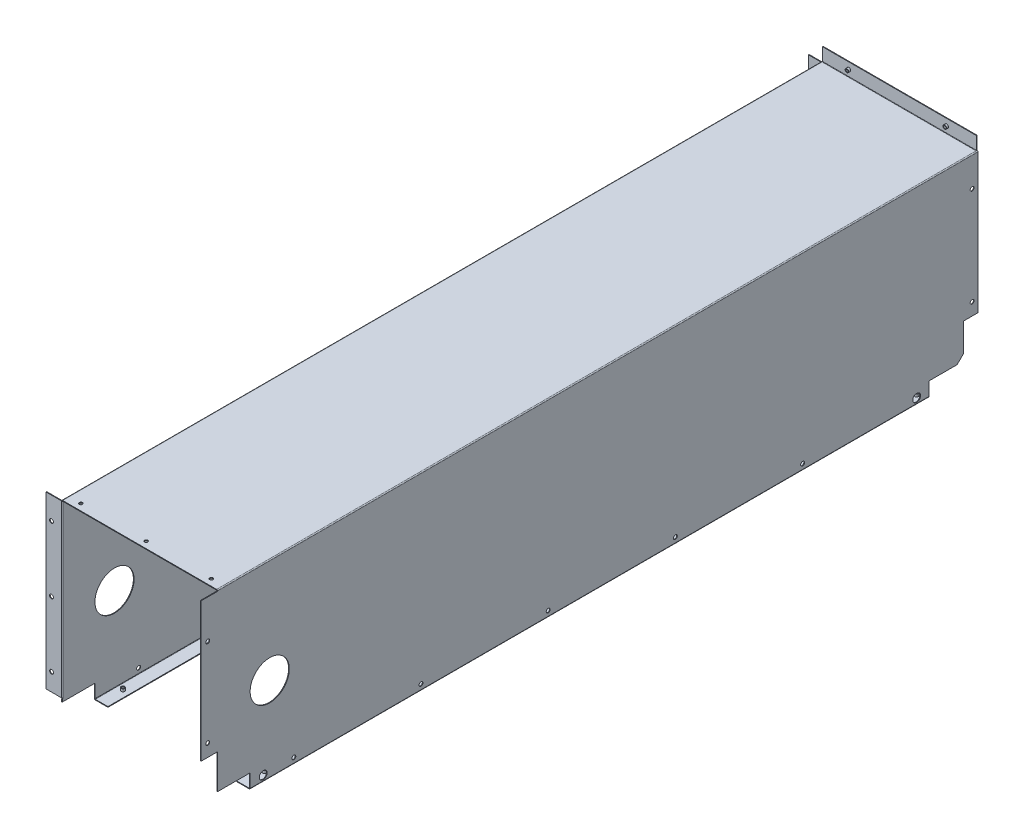
from build123d import *

# Parameters (mm, degrees)
SM_BASE_FLANGE_1_DEPTH           = 583
CUT_EXTRUDE_1_REACH              = 695.621
CHAMFER_1_SIZE                   = 10
CUT_EXTRUDE_2_REACH              = 695.621
SKETCH_4_W                       = 108.020797234
SKETCH_4_H                       = 89.185663408
SKETCH_4_W_2                     = 69.975402199
SKETCH_4_H_2                     = 56.987896811
CUT_EXTRUDE_3_REACH              = 695.621
SKETCH_8_R                       = 60
SKETCH_8_R_2                     = 3
SKETCH_9_R                       = 30
CUT_EXTRUDE_4_DEPTH              = 694.62093394
CUT_EXTRUDE_5_REACH              = 695.621
SKETCH_10_W                      = 58.039698727
SKETCH_10_H                      = 28.57153795
SKETCH_11_W                      = 25
SKETCH_11_H                      = 213
SM_BASE_FLANGE_1_2_DEPTH         = 1
CUT_EXTRUDE_6_REACH              = 716.762
SKETCH_14_R                      = 3
SKETCH_14_R_2                    = 6
CUT_EXTRUDE_7_REACH              = 716.762
SKETCH_15_R                      = 3
CUT_EXTRUDE_8_REACH              = 685.714
SKETCH_16_R                      = 2.5
SM_EDGE_FLANGE_1_STRIP_W         = 5
SM_EDGE_FLANGE_1_STRIP_H         = 1
SM_EDGE_FLANGE_1_STRIP_CUT_DEPTH = 236
SM_EDGE_FLANGE_1_DEPTH           = 236
SM_EDGE_FLANGE_2_STRIP_W         = 5
SM_EDGE_FLANGE_2_STRIP_H         = 1
SM_EDGE_FLANGE_2_STRIP_CUT_DEPTH = 261.5
SM_EDGE_FLANGE_2_DEPTH           = 261.5
SM_START                         = -263.5
SM_EDGE_FLANGE_3_DEPTH           = 262
SM_EDGE_FLANGE_3_2_DEPTH         = 0.5
SM_START_2                       = -263
SM_EDGE_FLANGE_3_3_DEPTH         = 261.5
SM_EDGE_FLANGE_4_STRIP_W         = 5
SM_EDGE_FLANGE_4_STRIP_H         = 1
SM_EDGE_FLANGE_4_STRIP_CUT_DEPTH = 1042
SM_EDGE_FLANGE_4_DEPTH           = 1042
SM_EDGE_FLANGE_5_STRIP_W         = 5
SM_EDGE_FLANGE_5_STRIP_H         = 1
SM_EDGE_FLANGE_5_STRIP_CUT_DEPTH = 1041
SM_EDGE_FLANGE_5_DEPTH           = 1041
CUT_EXTRUDE_9_REACH              = 1211.098
SKETCH_32_R                      = 3
SKETCH_33_R                      = 2.75
EXTRUDE_1_DEPTH                  = 4
HOLE_WIZARD_M4_1_D               = 3.3
HOLE_WIZARD_M4_1_DEPTH           = 10.1
HOLE_WIZARD_M4_1_TIP             = 0.991420021
SKETCH_40_R                      = 2.75
EXTRUDE_2_DEPTH                  = 5
HOLE_WIZARD_M4_2_D               = 3.3
HOLE_WIZARD_M4_2_DEPTH           = 10.1
HOLE_WIZARD_M4_2_TIP             = 0.991420021


# Read off the part's stored shape, not the designer's step: 边线-法兰3
# Sheet-metal steps are written as plain solids
with BuildPart() as part:
    # Sketch 1 → Sm Base Flange 1 (new, symmetric)
    with BuildSketch(Plane.XY):
        with BuildLine():
            Line((-119.5, -290), (-119.5, -1.5))
            ThreePointArc((-119.5, -1.5), (-119.060660172, -0.439339828), (-118, 0))
            Line((-118, 0), (118, 0))
            ThreePointArc((118, 0), (119.060660172, -0.439339828), (119.5, -1.5))
            Line((119.5, -1.5), (119.5, -290))
            Line((119.5, -290), (118.5, -290))
            Line((118.5, -290), (118.5, -1.5))
            ThreePointArc((118.5, -1.5), (118.353553391, -1.146446609), (118, -1))
            Line((118, -1), (-118, -1))
            ThreePointArc((-118, -1), (-118.353553391, -1.146446609), (-118.5, -1.5))
            Line((-118.5, -1.5), (-118.5, -290))
            Line((-118.5, -290), (-119.5, -290))
        make_face()
    extrude(amount=SM_BASE_FLANGE_1_DEPTH, both=True)

    # 草图3 → 切除-拉伸1 (cut, up to next)
    with BuildSketch(Plane(origin=(119.5, 0, 0), x_dir=(0, 0, -1), z_dir=(1, 0, 0)), mode=Mode.PRIVATE) as cut_extrude_1_sk1:
        Polygon((593.613938017, -215), (561, -215), (561, -268), (508, -268), (508, -307.31737372), (593.613938017, -307.31737372), align=None)
    cut_extrude_1_tool1 = extrude(cut_extrude_1_sk1.sketch, amount=-CUT_EXTRUDE_1_REACH, mode=Mode.PRIVATE) & part.part
    add(cut_extrude_1_tool1.solids().sort_by_distance((119.5, -271.997745, -559.798017))[0], mode=Mode.SUBTRACT)

    # 倒角1
    chamfer_1_edges = [part.edges().sort_by_distance(p)[0] for p in [
        (119, -268, -561),
    ]]
    chamfer(chamfer_1_edges, length=CHAMFER_1_SIZE)

    # 草图4 → 切除-拉伸2 (cut, up to next)
    with BuildSketch(Plane.ZY.offset(119.5), mode=Mode.PRIVATE) as cut_extrude_2_sk1:
        with Locations((-563.010398617, -307.592831704)):
            Rectangle(SKETCH_4_W, SKETCH_4_H)
    cut_extrude_2_tool1 = extrude(cut_extrude_2_sk1.sketch, amount=-CUT_EXTRUDE_2_REACH, mode=Mode.PRIVATE) & part.part
    # 草图4 → 切除-拉伸2 (cut, up to next)
    with BuildSketch(Plane.ZY.offset(119.5), mode=Mode.PRIVATE) as cut_extrude_2_sk2:
        with Locations((567.9877011, -296.493948406)):
            Rectangle(SKETCH_4_W_2, SKETCH_4_H_2)
    cut_extrude_2_tool2 = extrude(cut_extrude_2_sk2.sketch, amount=-CUT_EXTRUDE_2_REACH, mode=Mode.PRIVATE) & part.part
    add(cut_extrude_2_tool1.solids().sort_by_distance((-119.5, -307.592832, -563.010399))[0], mode=Mode.SUBTRACT)
    add(cut_extrude_2_tool2.solids().sort_by_distance((-119.5, -296.493948, 567.987701))[0], mode=Mode.SUBTRACT)

    # 草图8 → 切除-拉伸3 (cut, up to next)
    with BuildSketch(Plane.ZY.offset(119.5), mode=Mode.PRIVATE) as cut_extrude_3_sk1:
        with Locations((-414.5, -105)):
            Circle(SKETCH_8_R)
    cut_extrude_3_tool1 = extrude(cut_extrude_3_sk1.sketch, amount=-CUT_EXTRUDE_3_REACH, mode=Mode.PRIVATE) & part.part
    # 草图8 → 切除-拉伸3 (cut, up to next)
    with BuildSketch(Plane.ZY.offset(119.5), mode=Mode.PRIVATE) as cut_extrude_3_sk2:
        with Locations((-467, -157.5)):
            Circle(SKETCH_8_R_2)
    cut_extrude_3_tool2 = extrude(cut_extrude_3_sk2.sketch, amount=-CUT_EXTRUDE_3_REACH, mode=Mode.PRIVATE) & part.part
    # 草图8 → 切除-拉伸3 (cut, up to next)
    with BuildSketch(Plane.ZY.offset(119.5), mode=Mode.PRIVATE) as cut_extrude_3_sk3:
        with Locations((-467, -52.5)):
            Circle(SKETCH_8_R_2)
    cut_extrude_3_tool3 = extrude(cut_extrude_3_sk3.sketch, amount=-CUT_EXTRUDE_3_REACH, mode=Mode.PRIVATE) & part.part
    # 草图8 → 切除-拉伸3 (cut, up to next)
    with BuildSketch(Plane.ZY.offset(119.5), mode=Mode.PRIVATE) as cut_extrude_3_sk4:
        with Locations((-362, -52.5)):
            Circle(SKETCH_8_R_2)
    cut_extrude_3_tool4 = extrude(cut_extrude_3_sk4.sketch, amount=-CUT_EXTRUDE_3_REACH, mode=Mode.PRIVATE) & part.part
    # 草图8 → 切除-拉伸3 (cut, up to next)
    with BuildSketch(Plane.ZY.offset(119.5), mode=Mode.PRIVATE) as cut_extrude_3_sk5:
        with Locations((-362, -157.5)):
            Circle(SKETCH_8_R_2)
    cut_extrude_3_tool5 = extrude(cut_extrude_3_sk5.sketch, amount=-CUT_EXTRUDE_3_REACH, mode=Mode.PRIVATE) & part.part
    add(cut_extrude_3_tool1.solids().sort_by_distance((-119.5, -105, -414.5))[0], mode=Mode.SUBTRACT)
    add(cut_extrude_3_tool2.solids().sort_by_distance((-119.5, -157.5, -467))[0], mode=Mode.SUBTRACT)
    add(cut_extrude_3_tool3.solids().sort_by_distance((-119.5, -52.5, -467))[0], mode=Mode.SUBTRACT)
    add(cut_extrude_3_tool4.solids().sort_by_distance((-119.5, -52.5, -362))[0], mode=Mode.SUBTRACT)
    add(cut_extrude_3_tool5.solids().sort_by_distance((-119.5, -157.5, -362))[0], mode=Mode.SUBTRACT)

    # 草图9 → 切除-拉伸4 (cut, through all)
    with BuildSketch(Plane.ZY.offset(119.5)):
        with Locations((503, -160)):
            Circle(SKETCH_9_R)
    extrude(amount=-CUT_EXTRUDE_4_DEPTH, mode=Mode.SUBTRACT)

    # 草图10 → 切除-拉伸5 (cut, up to next)
    with BuildSketch(Plane(origin=(119.5, 0, 0), x_dir=(0, 0, -1), z_dir=(1, 0, 0)), mode=Mode.PRIVATE) as cut_extrude_5_sk1:
        with Locations((-562.019849364, -282.285768975)):
            Rectangle(SKETCH_10_W, SKETCH_10_H)
    cut_extrude_5_tool1 = extrude(cut_extrude_5_sk1.sketch, amount=-CUT_EXTRUDE_5_REACH, mode=Mode.PRIVATE) & part.part
    add(cut_extrude_5_tool1.solids().sort_by_distance((119.5, -282.285769, 562.019849))[0], mode=Mode.SUBTRACT)

    # 草图11 → Sm Base Flange 1 2 (add)
    with BuildSketch(Plane(origin=(119.5, 0, 0), x_dir=(0, 0, -1), z_dir=(1, 0, 0))):
        with Locations((-595.5, -108.5)):
            Rectangle(SKETCH_11_W, SKETCH_11_H)
    extrude(amount=-SM_BASE_FLANGE_1_2_DEPTH)

    # 草图14 → 切除-拉伸6 (cut, up to next)
    with BuildSketch(Plane(origin=(119.5, 0, 0), x_dir=(0, 0, -1), z_dir=(1, 0, 0)), mode=Mode.PRIVATE) as cut_extrude_6_sk1:
        with Locations((-598, -61)):
            Circle(SKETCH_14_R)
    cut_extrude_6_tool1 = extrude(cut_extrude_6_sk1.sketch, amount=-CUT_EXTRUDE_6_REACH, mode=Mode.PRIVATE) & part.part
    # 草图14 → 切除-拉伸6 (cut, up to next)
    with BuildSketch(Plane(origin=(119.5, 0, 0), x_dir=(0, 0, -1), z_dir=(1, 0, 0)), mode=Mode.PRIVATE) as cut_extrude_6_sk2:
        with Locations((-598, -196)):
            Circle(SKETCH_14_R)
    cut_extrude_6_tool2 = extrude(cut_extrude_6_sk2.sketch, amount=-CUT_EXTRUDE_6_REACH, mode=Mode.PRIVATE) & part.part
    # 草图14 → 切除-拉伸6 (cut, up to next)
    with BuildSketch(Plane(origin=(119.5, 0, 0), x_dir=(0, 0, -1), z_dir=(1, 0, 0)), mode=Mode.PRIVATE) as cut_extrude_6_sk3:
        with Locations((574, -46)):
            Circle(SKETCH_14_R)
    cut_extrude_6_tool3 = extrude(cut_extrude_6_sk3.sketch, amount=-CUT_EXTRUDE_6_REACH, mode=Mode.PRIVATE) & part.part
    # 草图14 → 切除-拉伸6 (cut, up to next)
    with BuildSketch(Plane(origin=(119.5, 0, 0), x_dir=(0, 0, -1), z_dir=(1, 0, 0)), mode=Mode.PRIVATE) as cut_extrude_6_sk4:
        with Locations((574, -196)):
            Circle(SKETCH_14_R)
    cut_extrude_6_tool4 = extrude(cut_extrude_6_sk4.sketch, amount=-CUT_EXTRUDE_6_REACH, mode=Mode.PRIVATE) & part.part
    # 草图14 → 切除-拉伸6 (cut, up to next)
    with BuildSketch(Plane(origin=(119.5, 0, 0), x_dir=(0, 0, -1), z_dir=(1, 0, 0)), mode=Mode.PRIVATE) as cut_extrude_6_sk5:
        with Locations((314, -281)):
            Circle(SKETCH_14_R)
    cut_extrude_6_tool5 = extrude(cut_extrude_6_sk5.sketch, amount=-CUT_EXTRUDE_6_REACH, mode=Mode.PRIVATE) & part.part
    # 草图14 → 切除-拉伸6 (cut, up to next)
    with BuildSketch(Plane(origin=(119.5, 0, 0), x_dir=(0, 0, -1), z_dir=(1, 0, 0)), mode=Mode.PRIVATE) as cut_extrude_6_sk6:
        with Locations((119, -281)):
            Circle(SKETCH_14_R)
    cut_extrude_6_tool6 = extrude(cut_extrude_6_sk6.sketch, amount=-CUT_EXTRUDE_6_REACH, mode=Mode.PRIVATE) & part.part
    # 草图14 → 切除-拉伸6 (cut, up to next)
    with BuildSketch(Plane(origin=(119.5, 0, 0), x_dir=(0, 0, -1), z_dir=(1, 0, 0)), mode=Mode.PRIVATE) as cut_extrude_6_sk7:
        with Locations((-76, -281)):
            Circle(SKETCH_14_R)
    cut_extrude_6_tool7 = extrude(cut_extrude_6_sk7.sketch, amount=-CUT_EXTRUDE_6_REACH, mode=Mode.PRIVATE) & part.part
    # 草图14 → 切除-拉伸6 (cut, up to next)
    with BuildSketch(Plane(origin=(119.5, 0, 0), x_dir=(0, 0, -1), z_dir=(1, 0, 0)), mode=Mode.PRIVATE) as cut_extrude_6_sk8:
        with Locations((-271, -281)):
            Circle(SKETCH_14_R)
    cut_extrude_6_tool8 = extrude(cut_extrude_6_sk8.sketch, amount=-CUT_EXTRUDE_6_REACH, mode=Mode.PRIVATE) & part.part
    # 草图14 → 切除-拉伸6 (cut, up to next)
    with BuildSketch(Plane(origin=(119.5, 0, 0), x_dir=(0, 0, -1), z_dir=(1, 0, 0)), mode=Mode.PRIVATE) as cut_extrude_6_sk9:
        with Locations((-466, -281)):
            Circle(SKETCH_14_R)
    cut_extrude_6_tool9 = extrude(cut_extrude_6_sk9.sketch, amount=-CUT_EXTRUDE_6_REACH, mode=Mode.PRIVATE) & part.part
    # 草图14 → 切除-拉伸6 (cut, up to next)
    with BuildSketch(Plane(origin=(119.5, 0, 0), x_dir=(0, 0, -1), z_dir=(1, 0, 0)), mode=Mode.PRIVATE) as cut_extrude_6_sk10:
        with Locations((489, -281)):
            Circle(SKETCH_14_R_2)
    cut_extrude_6_tool10 = extrude(cut_extrude_6_sk10.sketch, amount=-CUT_EXTRUDE_6_REACH, mode=Mode.PRIVATE) & part.part
    # 草图14 → 切除-拉伸6 (cut, up to next)
    with BuildSketch(Plane(origin=(119.5, 0, 0), x_dir=(0, 0, -1), z_dir=(1, 0, 0)), mode=Mode.PRIVATE) as cut_extrude_6_sk11:
        with Locations((-513, -281)):
            Circle(SKETCH_14_R_2)
    cut_extrude_6_tool11 = extrude(cut_extrude_6_sk11.sketch, amount=-CUT_EXTRUDE_6_REACH, mode=Mode.PRIVATE) & part.part
    add(cut_extrude_6_tool1.solids().sort_by_distance((119.5, -61, 598))[0], mode=Mode.SUBTRACT)
    add(cut_extrude_6_tool2.solids().sort_by_distance((119.5, -196, 598))[0], mode=Mode.SUBTRACT)
    add(cut_extrude_6_tool3.solids().sort_by_distance((119.5, -46, -574))[0], mode=Mode.SUBTRACT)
    add(cut_extrude_6_tool4.solids().sort_by_distance((119.5, -196, -574))[0], mode=Mode.SUBTRACT)
    add(cut_extrude_6_tool5.solids().sort_by_distance((119.5, -281, -314))[0], mode=Mode.SUBTRACT)
    add(cut_extrude_6_tool6.solids().sort_by_distance((119.5, -281, -119))[0], mode=Mode.SUBTRACT)
    add(cut_extrude_6_tool7.solids().sort_by_distance((119.5, -281, 76))[0], mode=Mode.SUBTRACT)
    add(cut_extrude_6_tool8.solids().sort_by_distance((119.5, -281, 271))[0], mode=Mode.SUBTRACT)
    add(cut_extrude_6_tool9.solids().sort_by_distance((119.5, -281, 466))[0], mode=Mode.SUBTRACT)
    add(cut_extrude_6_tool10.solids().sort_by_distance((119.5, -281, -489))[0], mode=Mode.SUBTRACT)
    add(cut_extrude_6_tool11.solids().sort_by_distance((119.5, -281, 513))[0], mode=Mode.SUBTRACT)

    # 草图15 → 切除-拉伸7 (cut, up to next)
    with BuildSketch(Plane.ZY.offset(119.5), mode=Mode.PRIVATE) as cut_extrude_7_sk1:
        with Locations(Location((-314, -281, 0), (0, 0, 180))):
            Circle(SKETCH_15_R)
    cut_extrude_7_tool1 = extrude(cut_extrude_7_sk1.sketch, amount=-CUT_EXTRUDE_7_REACH, mode=Mode.PRIVATE) & part.part
    # 草图15 → 切除-拉伸7 (cut, up to next)
    with BuildSketch(Plane.ZY.offset(119.5), mode=Mode.PRIVATE) as cut_extrude_7_sk2:
        with Locations(Location((-119, -281, 0), (0, 0, 180))):
            Circle(SKETCH_15_R)
    cut_extrude_7_tool2 = extrude(cut_extrude_7_sk2.sketch, amount=-CUT_EXTRUDE_7_REACH, mode=Mode.PRIVATE) & part.part
    # 草图15 → 切除-拉伸7 (cut, up to next)
    with BuildSketch(Plane.ZY.offset(119.5), mode=Mode.PRIVATE) as cut_extrude_7_sk3:
        with Locations(Location((76, -281, 0), (0, 0, 180))):
            Circle(SKETCH_15_R)
    cut_extrude_7_tool3 = extrude(cut_extrude_7_sk3.sketch, amount=-CUT_EXTRUDE_7_REACH, mode=Mode.PRIVATE) & part.part
    # 草图15 → 切除-拉伸7 (cut, up to next)
    with BuildSketch(Plane.ZY.offset(119.5), mode=Mode.PRIVATE) as cut_extrude_7_sk4:
        with Locations(Location((271, -281, 0), (0, 0, 180))):
            Circle(SKETCH_15_R)
    cut_extrude_7_tool4 = extrude(cut_extrude_7_sk4.sketch, amount=-CUT_EXTRUDE_7_REACH, mode=Mode.PRIVATE) & part.part
    # 草图15 → 切除-拉伸7 (cut, up to next)
    with BuildSketch(Plane.ZY.offset(119.5), mode=Mode.PRIVATE) as cut_extrude_7_sk5:
        with Locations(Location((466, -281, 0), (0, 0, 180))):
            Circle(SKETCH_15_R)
    cut_extrude_7_tool5 = extrude(cut_extrude_7_sk5.sketch, amount=-CUT_EXTRUDE_7_REACH, mode=Mode.PRIVATE) & part.part
    add(cut_extrude_7_tool1.solids().sort_by_distance((-119.5, -281, -314))[0], mode=Mode.SUBTRACT)
    add(cut_extrude_7_tool2.solids().sort_by_distance((-119.5, -281, -119))[0], mode=Mode.SUBTRACT)
    add(cut_extrude_7_tool3.solids().sort_by_distance((-119.5, -281, 76))[0], mode=Mode.SUBTRACT)
    add(cut_extrude_7_tool4.solids().sort_by_distance((-119.5, -281, 271))[0], mode=Mode.SUBTRACT)
    add(cut_extrude_7_tool5.solids().sort_by_distance((-119.5, -281, 466))[0], mode=Mode.SUBTRACT)

    # 草图16 → 切除-拉伸8 (cut, up to next)
    with BuildSketch(Plane.XZ.offset(1), mode=Mode.PRIVATE) as cut_extrude_8_sk1:
        with Locations(Location((0, 573, 0), (0, 0, 270))):
            Circle(SKETCH_16_R)
    cut_extrude_8_tool1 = extrude(cut_extrude_8_sk1.sketch, amount=-CUT_EXTRUDE_8_REACH, mode=Mode.PRIVATE) & part.part
    # 草图16 → 切除-拉伸8 (cut, up to next)
    with BuildSketch(Plane.XZ.offset(1), mode=Mode.PRIVATE) as cut_extrude_8_sk2:
        with Locations(Location((100, 573, 0), (0, 0, 270))):
            Circle(SKETCH_16_R)
    cut_extrude_8_tool2 = extrude(cut_extrude_8_sk2.sketch, amount=-CUT_EXTRUDE_8_REACH, mode=Mode.PRIVATE) & part.part
    # 草图16 → 切除-拉伸8 (cut, up to next)
    with BuildSketch(Plane.XZ.offset(1), mode=Mode.PRIVATE) as cut_extrude_8_sk3:
        with Locations(Location((-100, 573, 0), (0, 0, 270))):
            Circle(SKETCH_16_R)
    cut_extrude_8_tool3 = extrude(cut_extrude_8_sk3.sketch, amount=-CUT_EXTRUDE_8_REACH, mode=Mode.PRIVATE) & part.part
    add(cut_extrude_8_tool1.solids().sort_by_distance((0, -1, 573))[0], mode=Mode.SUBTRACT)
    add(cut_extrude_8_tool2.solids().sort_by_distance((100, -1, 573))[0], mode=Mode.SUBTRACT)
    add(cut_extrude_8_tool3.solids().sort_by_distance((-100, -1, 573))[0], mode=Mode.SUBTRACT)

    # 边线-法兰1 strip (across the edge) → 边线-法兰1 strip cut (cut)
    with BuildSketch(Plane(origin=(118, 0, -583), x_dir=(0, 0, 1), z_dir=(-1, 0, 0))):
        with Locations((-1, -0.5)):
            Rectangle(SM_EDGE_FLANGE_1_STRIP_W, SM_EDGE_FLANGE_1_STRIP_H)
    extrude(amount=SM_EDGE_FLANGE_1_STRIP_CUT_DEPTH, mode=Mode.SUBTRACT)

    # 边线-法兰1 section (across the edge) → 边线-法兰1 (add)
    with BuildSketch(Plane(origin=(118, 0, -583), x_dir=(0, 0, 1), z_dir=(-1, 0, 0))):
        with BuildLine():
            Line((0, 0.5), (0, 20))
            Line((0, 20), (1, 20))
            Line((1, 20), (1, 0.5))
            ThreePointArc((1, 0.5), (1.146446609, 0.146446609), (1.5, 0))
            Line((1.5, 0), (1.5, -1))
            ThreePointArc((1.5, -1), (0.439339828, -0.560660172), (0, 0.5))
        make_face()
    extrude(amount=SM_EDGE_FLANGE_1_DEPTH)

    # 边线-法兰2 strip (across the edge) → 边线-法兰2 strip cut (cut)
    with BuildSketch(Plane(origin=(-119.5, -1.5, -583), x_dir=(0, 0, 1), z_dir=(0, -1, 0))):
        with Locations((-1, -0.5)):
            Rectangle(SM_EDGE_FLANGE_2_STRIP_W, SM_EDGE_FLANGE_2_STRIP_H)
    extrude(amount=SM_EDGE_FLANGE_2_STRIP_CUT_DEPTH, mode=Mode.SUBTRACT)

    # 边线-法兰2 section (across the edge) → 边线-法兰2 (add)
    with BuildSketch(Plane(origin=(-119.5, -1.5, -583), x_dir=(0, 0, 1), z_dir=(0, -1, 0))):
        with BuildLine():
            Line((0, 0.5), (0, 20))
            Line((0, 20), (1, 20))
            Line((1, 20), (1, 0.5))
            ThreePointArc((1, 0.5), (1.146446609, 0.146446609), (1.5, 0))
            Line((1.5, 0), (1.5, -1))
            ThreePointArc((1.5, -1), (0.439339828, -0.560660172), (0, 0.5))
        make_face()
    extrude(amount=SM_EDGE_FLANGE_2_DEPTH)

    # 边线-法兰3 outline → 边线-法兰3 (cut)
    with BuildSketch(Plane(origin=(0, 0, 0), x_dir=(1, 0, 0), z_dir=(0, 1, 0)).offset(SM_START)):
        with BuildLine():
            ThreePointArc((-118.5, -581.5), (-118.775255128, -582.366025404), (-119.5, -582.914213563))
            Line((-119.5, -582.914213563), (-119.5, -583))
            Line((-119.5, -583), (-118.5, -583))
            Line((-118.5, -583), (-118.5, -581.5))
        make_face()
    extrude(amount=SM_EDGE_FLANGE_3_DEPTH, mode=Mode.SUBTRACT)

    # Sm Edge Flange 3 2 outline → Sm Edge Flange 3 2 (cut)
    with BuildSketch(Plane(origin=(0, 0, 0), x_dir=(1, 0, 0), z_dir=(0, 1, 0)).offset(SM_START)):
        with BuildLine():
            Line((-119.5, -581), (-119.5, -582.914213563))
            ThreePointArc((-119.5, -582.914213563), (-118.775255128, -582.366025404), (-118.5, -581.5))
            Line((-118.5, -581.5), (-118.5, -581))
            Line((-118.5, -581), (-119.5, -581))
        make_face()
    extrude(amount=SM_EDGE_FLANGE_3_2_DEPTH, mode=Mode.SUBTRACT)

    # Sm Edge Flange 3 3 outline → Sm Edge Flange 3 3 (add)
    with BuildSketch(Plane(origin=(0, 0, 0), x_dir=(1, 0, 0), z_dir=(0, 1, 0)).offset(SM_START_2)):
        with BuildLine():
            Line((-143.5, -583), (-120, -583))
            ThreePointArc((-120, -583), (-119.746347032, -582.97839784), (-119.5, -582.914213563))
            Line((-119.5, -582.914213563), (-119.5, -581.5))
            ThreePointArc((-119.5, -581.5), (-119.646446609, -581.853553391), (-120, -582))
            Line((-120, -582), (-143.5, -582))
            Line((-143.5, -582), (-143.5, -583))
        make_face()
    extrude(amount=SM_EDGE_FLANGE_3_3_DEPTH)

    # 边线-法兰4 strip (across the edge) → 边线-法兰4 strip cut (cut)
    with BuildSketch(Plane(origin=(-118.5, -290, 533), x_dir=(0, 1, 0), z_dir=(0, 0, -1))):
        with Locations((-1, -0.5)):
            Rectangle(SM_EDGE_FLANGE_4_STRIP_W, SM_EDGE_FLANGE_4_STRIP_H)
    extrude(amount=SM_EDGE_FLANGE_4_STRIP_CUT_DEPTH, mode=Mode.SUBTRACT)

    # 边线-法兰4 section (across the edge) → 边线-法兰4 (add)
    with BuildSketch(Plane(origin=(-118.5, -290, 533), x_dir=(0, 1, 0), z_dir=(0, 0, -1))):
        with BuildLine():
            Line((0, 0.5), (0, 20))
            Line((0, 20), (1, 20))
            Line((1, 20), (1, 0.5))
            ThreePointArc((1, 0.5), (1.146446609, 0.146446609), (1.5, 0))
            Line((1.5, 0), (1.5, -1))
            ThreePointArc((1.5, -1), (0.439339828, -0.560660172), (0, 0.5))
        make_face()
    extrude(amount=SM_EDGE_FLANGE_4_DEPTH)

    # 边线-法兰5 strip (across the edge) → 边线-法兰5 strip cut (cut)
    with BuildSketch(Plane(origin=(118.5, -290, -508), x_dir=(0, 1, 0), z_dir=(0, 0, 1))):
        with Locations((-1, -0.5)):
            Rectangle(SM_EDGE_FLANGE_5_STRIP_W, SM_EDGE_FLANGE_5_STRIP_H)
    extrude(amount=SM_EDGE_FLANGE_5_STRIP_CUT_DEPTH, mode=Mode.SUBTRACT)

    # 边线-法兰5 section (across the edge) → 边线-法兰5 (add)
    with BuildSketch(Plane(origin=(118.5, -290, -508), x_dir=(0, 1, 0), z_dir=(0, 0, 1))):
        with BuildLine():
            Line((0, 0.5), (0, 20))
            Line((0, 20), (1, 20))
            Line((1, 20), (1, 0.5))
            ThreePointArc((1, 0.5), (1.146446609, 0.146446609), (1.5, 0))
            Line((1.5, 0), (1.5, -1))
            ThreePointArc((1.5, -1), (0.439339828, -0.560660172), (0, 0.5))
        make_face()
    extrude(amount=SM_EDGE_FLANGE_5_DEPTH)

    # 草图32 → 切除-拉伸9 (cut, up to next)
    with BuildSketch(Plane(origin=(0, 0, 582), x_dir=(-1, 0, 0), z_dir=(0, 0, -1)), mode=Mode.PRIVATE) as cut_extrude_9_sk1:
        with Locations((135, -136)):
            Circle(SKETCH_32_R)
    cut_extrude_9_tool1 = extrude(cut_extrude_9_sk1.sketch, amount=-CUT_EXTRUDE_9_REACH, mode=Mode.PRIVATE) & part.part
    # 草图32 → 切除-拉伸9 (cut, up to next)
    with BuildSketch(Plane(origin=(0, 0, 582), x_dir=(-1, 0, 0), z_dir=(0, 0, -1)), mode=Mode.PRIVATE) as cut_extrude_9_sk2:
        with Locations((135, -36)):
            Circle(SKETCH_32_R)
    cut_extrude_9_tool2 = extrude(cut_extrude_9_sk2.sketch, amount=-CUT_EXTRUDE_9_REACH, mode=Mode.PRIVATE) & part.part
    # 草图32 → 切除-拉伸9 (cut, up to next)
    with BuildSketch(Plane(origin=(0, 0, 582), x_dir=(-1, 0, 0), z_dir=(0, 0, -1)), mode=Mode.PRIVATE) as cut_extrude_9_sk3:
        with Locations((135, -236)):
            Circle(SKETCH_32_R)
    cut_extrude_9_tool3 = extrude(cut_extrude_9_sk3.sketch, amount=-CUT_EXTRUDE_9_REACH, mode=Mode.PRIVATE) & part.part
    add(cut_extrude_9_tool1.solids().sort_by_distance((-135, -136, 582))[0], mode=Mode.SUBTRACT)
    add(cut_extrude_9_tool2.solids().sort_by_distance((-135, -36, 582))[0], mode=Mode.SUBTRACT)
    add(cut_extrude_9_tool3.solids().sort_by_distance((-135, -236, 582))[0], mode=Mode.SUBTRACT)

    # 草图33 → 凸台-拉伸1 (add)
    with BuildSketch(Plane(origin=(0, 0, -583), x_dir=(-1, 0, 0), z_dir=(0, 0, -1))):
        with Locations(Location((-72.5, 10, 0), (0, 0, 90))):
            Circle(SKETCH_33_R)
        with Locations(Location((77.5, 10, 0), (0, 0, 90))):
            Circle(SKETCH_33_R)
        with Locations(Location((129.5, -57, 0), (0, 0, 90))):
            Circle(SKETCH_33_R)
        with Locations(Location((129.5, -207, 0), (0, 0, 90))):
            Circle(SKETCH_33_R)
    extrude(amount=-EXTRUDE_1_DEPTH)

    # M4 螺纹孔1
    with Locations(Plane(origin=(0, 0, -583), x_dir=(-1, 0, 0), z_dir=(0, 0, -1))):
        with Locations((77.5, 10), (-72.5, 10), (129.5, -57), (129.5, -207)):
            Hole(HOLE_WIZARD_M4_1_D / 2, depth=HOLE_WIZARD_M4_1_DEPTH)
            with Locations((0, 0, -(HOLE_WIZARD_M4_1_DEPTH + HOLE_WIZARD_M4_1_TIP / 2))):  # 118° drill point
                Cone(0, HOLE_WIZARD_M4_1_D / 2, HOLE_WIZARD_M4_1_TIP, mode=Mode.SUBTRACT)

    # 草图40 → 凸台-拉伸2 (add)
    with BuildSketch(Plane.XZ.offset(290)):
        with Locations((108.5, -500)):
            Circle(SKETCH_40_R)
        with Locations((108.5, -250)):
            Circle(SKETCH_40_R)
        with Locations((108.5, 0)):
            Circle(SKETCH_40_R)
        with Locations((108.5, 250)):
            Circle(SKETCH_40_R)
        with Locations((108.5, 500)):
            Circle(SKETCH_40_R)
        with Locations((-108.5, 500)):
            Circle(SKETCH_40_R)
        with Locations((-108.5, 250)):
            Circle(SKETCH_40_R)
        with Locations((-108.5, 0)):
            Circle(SKETCH_40_R)
        with Locations((-108.5, -250)):
            Circle(SKETCH_40_R)
        with Locations((-108.5, -500)):
            Circle(SKETCH_40_R)
    extrude(amount=-EXTRUDE_2_DEPTH)

    # M4 螺纹孔2
    with Locations(Plane.XZ.offset(290)):
        with Locations((108.5, -500), (108.5, -250), (108.5, 0), (108.5, 250), (108.5, 500), (-108.5, 500), (-108.5, 250), (-108.5, 0), (-108.5, -250), (-108.5, -500)):
            Hole(HOLE_WIZARD_M4_2_D / 2, depth=HOLE_WIZARD_M4_2_DEPTH)
            with Locations((0, 0, -(HOLE_WIZARD_M4_2_DEPTH + HOLE_WIZARD_M4_2_TIP / 2))):  # 118° drill point
                Cone(0, HOLE_WIZARD_M4_2_D / 2, HOLE_WIZARD_M4_2_TIP, mode=Mode.SUBTRACT)


solid = part.part
